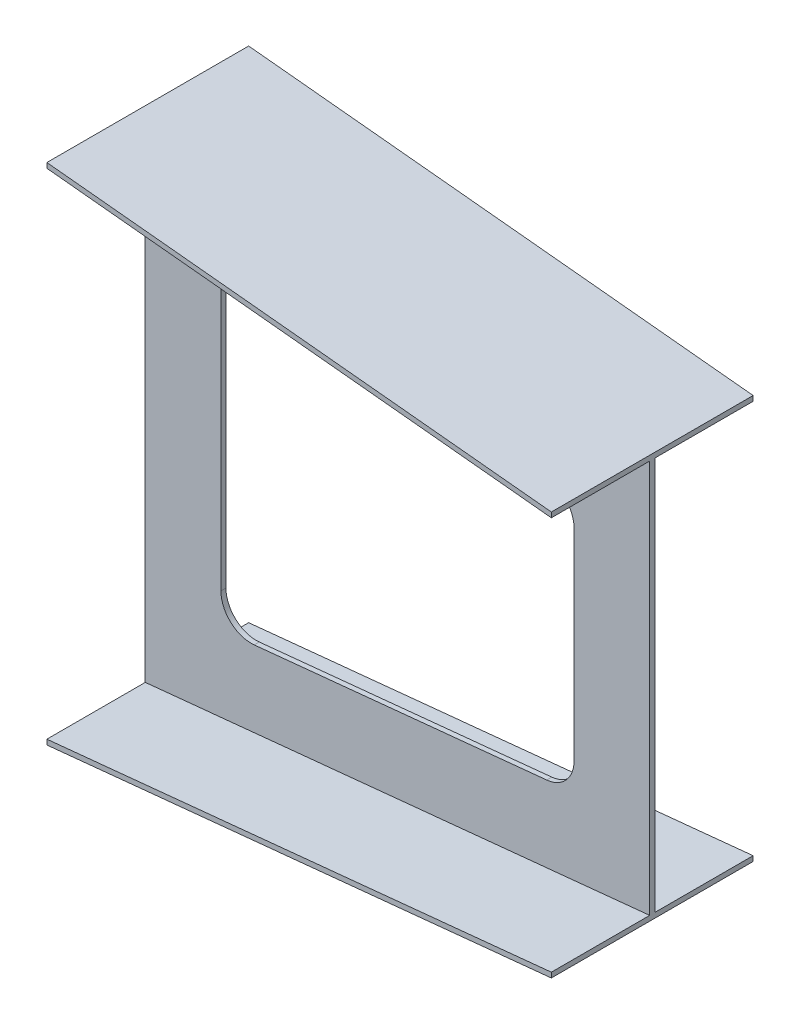
from build123d import *

# Parameters (mm, degrees)
CUT_EXTRUDE1_DEPTH = 10


with BuildPart() as part:
    # Sketch1 → Loft4 section 0
    with BuildSketch(Plane(origin=(0, 0, 0), x_dir=(0, 0, -1), z_dir=(1, 0, 0))):
        with BuildLine():
            Line((-205, 500), (195, 500))
            Line((195, 500), (195, 490))
            Line((195, 490), (0, 490))
            Line((0, 490), (0, -490))
            Line((0, -490), (195, -490))
            Line((195, -490), (195, -500))
            Line((195, -500), (-205, -500))
            Line((-205, -500), (-205, -490))
            Line((-205, -490), (-10, -490))
            Line((-10, -490), (-10, 490))
            Line((-10, 490), (-205, 490))
            Line((-205, 490), (-205, 500))
        make_face()
    # Sketch4 → Loft4 section 1
    with BuildSketch(Plane(origin=(1000, 0, -1000), x_dir=(0, 0, 1), z_dir=(-1, 0, 0))):
        with BuildLine():
            Line((805, 400), (1205, 400))
            Line((1205, 400), (1205, 390))
            Line((1205, 390), (1010, 390))
            Line((1010, 390), (1010, -390))
            Line((1010, -390), (1205, -390))
            Line((1205, -390), (1205, -400))
            Line((1205, -400), (805, -400))
            Line((805, -400), (805, -390))
            Line((805, -390), (1000, -390))
            Line((1000, -390), (1000, 390))
            Line((1000, 390), (805, 390))
            Line((805, 390), (805, 400))
        make_face()
    loft()

    # Sketch6 → Cut-Extrude1 (cut)
    with BuildSketch(Plane.XY.offset(10)):
        with BuildLine():
            Line((215.970223141, -317.654843369), (795.970223141, -259.654843369))
            ThreePointArc((795.970223141, -259.654843369), (834.487152013, -240.212931202), (850, -199.952611956))
            Line((850, -199.952611956), (850, 199.952611956))
            ThreePointArc((850, 199.952611956), (834.487152013, 240.212931202), (795.970223141, 259.654843369))
            Line((795.970223141, 259.654843369), (215.970223141, 317.654843369))
            ThreePointArc((215.970223141, 317.654843369), (169.739680754, 302.43976397), (150, 257.952611956))
            Line((150, 257.952611956), (150, -257.952611956))
            ThreePointArc((150, -257.952611956), (169.739680754, -302.43976397), (215.970223141, -317.654843369))
        make_face()
    extrude(amount=-CUT_EXTRUDE1_DEPTH, mode=Mode.SUBTRACT)


solid = part.part
